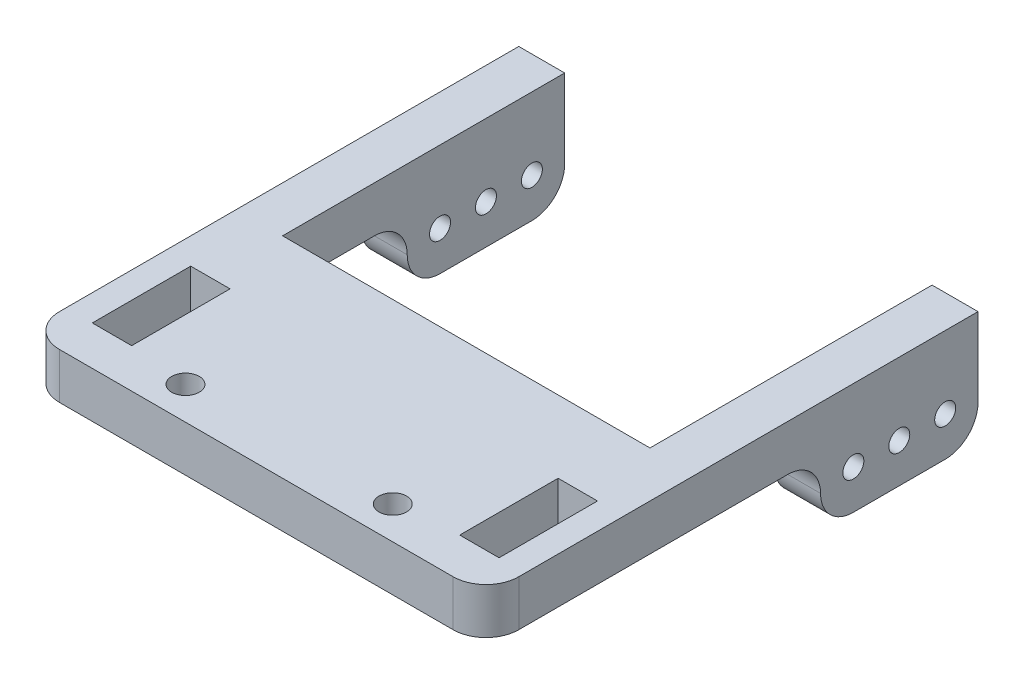
from build123d import *

# Parameters (mm, degrees)
SKETCH_1_W          = 6
SKETCH_1_H          = 15
EXTRUDE_1_DEPTH     = 7
SKETCH_2_W          = 7
SKETCH_2_H          = 24
EXTRUDE_2_DEPTH     = 10
SKETCH_3_R          = 1.6
CUT_EXTRUDE_1_DEPTH = 104.07764064
CUT_EXTRUDE_2_REACH = 105.99
SKETCH_7_R          = 2.1
FILLET_1_R          = 5


with BuildPart() as part:
    # 草图1 → 凸台-拉伸1 (new body)
    with BuildSketch(Plane(origin=(0, 0, 0), x_dir=(1, 0, 0), z_dir=(0, 1, 0))):
        Polygon((7, -43), (63, -43), (63, 0), (70, 0), (70, -75), (0, -75), (0, 0), (7, 0), align=None)
        with Locations((63, -61.5)):
            Rectangle(SKETCH_1_W, SKETCH_1_H, mode=Mode.SUBTRACT)
        with Locations((7, -61.5)):
            Rectangle(SKETCH_1_W, SKETCH_1_H, mode=Mode.SUBTRACT)
    extrude(amount=EXTRUDE_1_DEPTH)

    # 草图2 → 凸台-拉伸2 (add)
    with BuildSketch(Plane.XZ):
        with Locations((3.5, 12)):
            Rectangle(SKETCH_2_W, SKETCH_2_H)
        with Locations((66.5, 12)):
            Rectangle(SKETCH_2_W, SKETCH_2_H)
    extrude(amount=EXTRUDE_2_DEPTH)

    # 草图3 → 切除-拉伸1 (cut, through all)
    with BuildSketch(Plane(origin=(70, 0, 0), x_dir=(0, 0, -1), z_dir=(1, 0, 0))):
        with Locations((-12, -4)):
            Circle(SKETCH_3_R)
        with Locations((-19, -4)):
            Circle(SKETCH_3_R)
        with Locations((-5, -4)):
            Circle(SKETCH_3_R)
    extrude(amount=-CUT_EXTRUDE_1_DEPTH, mode=Mode.SUBTRACT)

    # 草图7 → 切除-拉伸2 (cut, up to next)
    with BuildSketch(Plane(origin=(0, 7, 0), x_dir=(1, 0, 0), z_dir=(0, 1, 0)), mode=Mode.PRIVATE) as cut_extrude_2_sk1:
        with Locations(Location((19.2, -70, 0), (0, 0, 270))):
            Circle(SKETCH_7_R)
    cut_extrude_2_tool1 = extrude(cut_extrude_2_sk1.sketch, amount=-CUT_EXTRUDE_2_REACH, mode=Mode.PRIVATE) & part.part
    # 草图7 → 切除-拉伸2 (cut, up to next)
    with BuildSketch(Plane(origin=(0, 7, 0), x_dir=(1, 0, 0), z_dir=(0, 1, 0)), mode=Mode.PRIVATE) as cut_extrude_2_sk2:
        with Locations(Location((50.8, -70, 0), (0, 0, 270))):
            Circle(SKETCH_7_R)
    cut_extrude_2_tool2 = extrude(cut_extrude_2_sk2.sketch, amount=-CUT_EXTRUDE_2_REACH, mode=Mode.PRIVATE) & part.part
    add(cut_extrude_2_tool1.solids().sort_by_distance((19.2, 7, 70))[0], mode=Mode.SUBTRACT)
    add(cut_extrude_2_tool2.solids().sort_by_distance((50.8, 7, 70))[0], mode=Mode.SUBTRACT)

    # 圆角1
    fillet_1_edges = [part.edges().sort_by_distance(p)[0] for p in [
        (70, 3.5, 75),
        (0, 3.5, 75),
        (66.5, -10, 24),
        (66.5, 0, 24),
        (66.5, -10, 0),
        (3.5, -10, 0),
        (3.5, -10, 24),
        (3.5, 0, 24),
    ]]
    fillet(fillet_1_edges, radius=FILLET_1_R - 0.0001)  # a hair under: the kernel refuses the full size


solid = part.part
